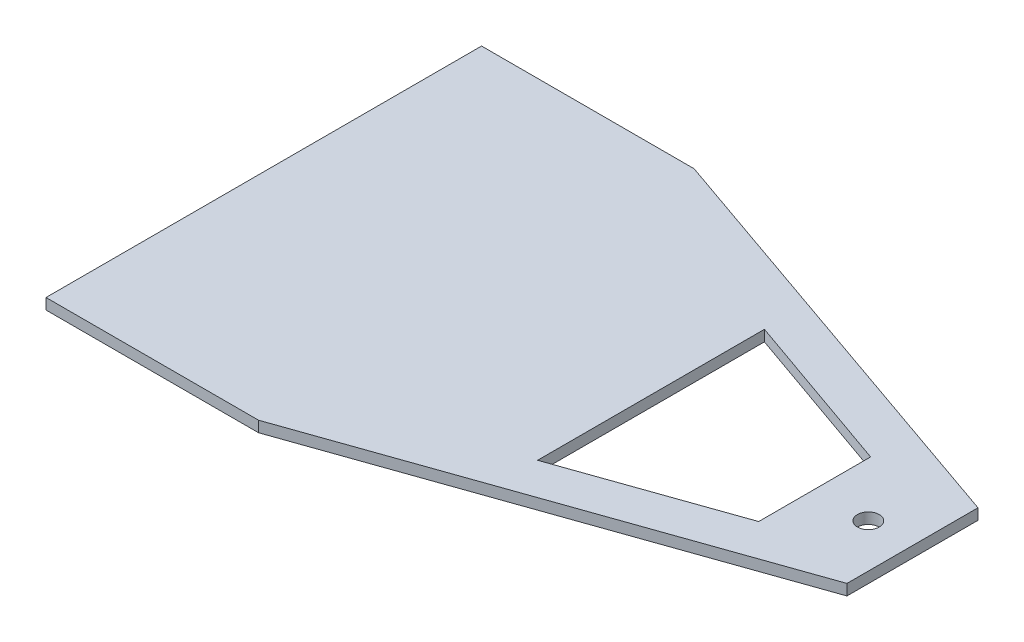
from build123d import *

# Parameters (mm, degrees)
BOSS_EXTRUDE1_DEPTH = 3.175


with BuildPart() as part:
    # Sketch1 → Boss-Extrude1 (new body)
    with BuildSketch(Plane(origin=(0, 0, 0), x_dir=(1, 0, 0), z_dir=(0, 1, 0))):
        Polygon((0, 127), (0, 0), (61.976, 0), (188.976, 44.5716583), (188.976, 82.778533838), (61.976, 127), align=None)
        Polygon((160.478170111, 79.961770304), (160.478170111, 63.5), (160.478170111, 47.326176586), (112.776, 30.556696538), (112.776, 63.5), (112.776, 96.704367772), align=None, mode=Mode.SUBTRACT)
        with BuildLine():
            ThreePointArc((179.451, 63.5), (176.276, 60.325), (173.101, 63.5))
            ThreePointArc((173.101, 63.5), (176.276, 66.675), (179.451, 63.5))
        make_face(mode=Mode.SUBTRACT)
    extrude(amount=BOSS_EXTRUDE1_DEPTH)


solid = part.part
